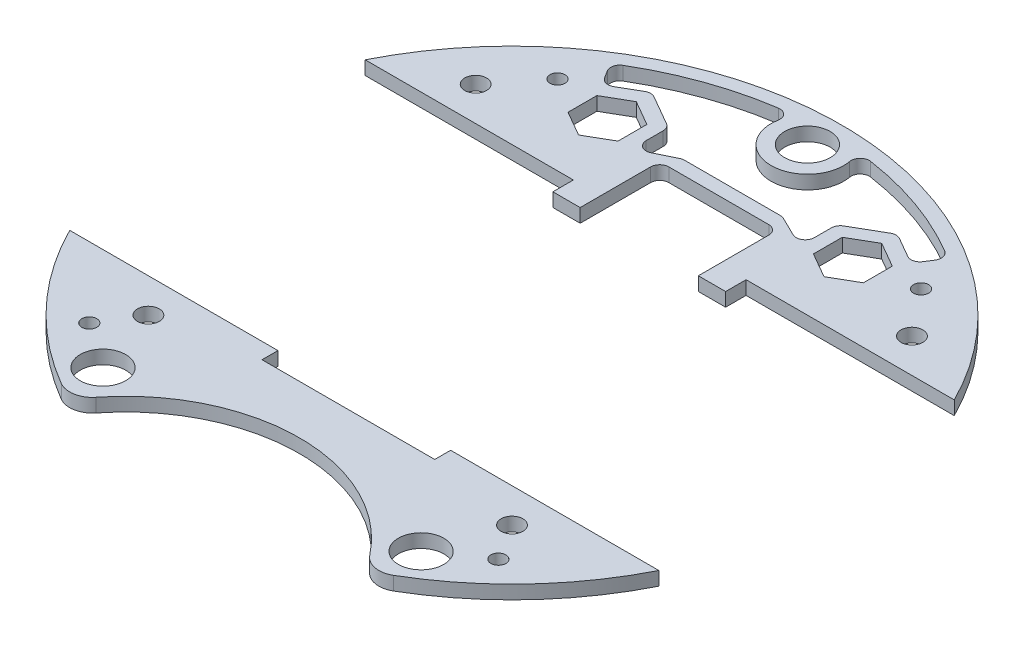
from build123d import *

# Parameters (mm, degrees)
BOSS_EXTRUDE1_DEPTH  = 3
SOLENOID_PLACEMENT_W = 38
SOLENOID_PLACEMENT_H = 64
CUT_EXTRUDE1_DEPTH   = 103.574363269
CUT_EXTRUDE4_DEPTH   = 103.574363269
CUT_EXTRUDE5_DEPTH   = 103.574363269
SKETCH6_R            = 2.4
CUT_EXTRUDE6_DEPTH   = 103.574363269
CUT_EXTRUDE3_DEPTH   = 103.574363269
SKETCH7_R            = 5
CUT_EXTRUDE7_DEPTH   = 98.289516393
SKETCH8_R            = 5
CUT_EXTRUDE9_DEPTH   = 98.289516393
SKETCH9_R            = 1.65
CUT_EXTRUDE10_DEPTH  = 98.289516393
CUT_EXTRUDE12_DEPTH  = 98.289516393


with BuildPart() as part:
    # Sketch1 → Boss-Extrude1 (new body)
    with BuildSketch(Plane(origin=(0, 0, 0), x_dir=(1, 0, 0), z_dir=(0, 1, 0))):
        with BuildLine():
            ThreePointArc((36.543377003, -62.616544118), (0, 72.5), (-36.543377003, -62.616544118))
            ThreePointArc((-36.543377003, -62.616544118), (-33.085954668, -63.20954405), (-30.089832649, -61.38507948))
            ThreePointArc((-30.089832649, -61.38507948), (0, -46.75), (30.089832649, -61.38507948))
            ThreePointArc((30.089832649, -61.38507948), (33.085954668, -63.20954405), (36.543377003, -62.616544118))
        make_face()
    extrude(amount=BOSS_EXTRUDE1_DEPTH)

    # solenoid placement → Cut-Extrude1 (cut, through all)
    with BuildSketch(Plane(origin=(0, 3, 0), x_dir=(1, 0, 0), z_dir=(0, 1, 0))):
        with Locations((0, -4)):
            Rectangle(SOLENOID_PLACEMENT_W, SOLENOID_PLACEMENT_H)
    extrude(amount=-CUT_EXTRUDE1_DEPTH, mode=Mode.SUBTRACT)

    # Sketch4 → Cut-Extrude4 (cut, through all)
    with BuildSketch(Plane(origin=(0, 3, 0), x_dir=(1, 0, 0), z_dir=(0, 1, 0))):
        with BuildLine():
            Line((13, 28), (13, 43.5))
            ThreePointArc((13, 43.5), (12.414213562, 44.914213562), (11, 45.5))
            Line((11, 45.5), (-11, 45.5))
            ThreePointArc((-11, 45.5), (-12.414213562, 44.914213562), (-13, 43.5))
            Line((-13, 43.5), (-13, 28))
            Line((-13, 28), (13, 28))
        make_face()
    extrude(amount=-CUT_EXTRUDE4_DEPTH, mode=Mode.SUBTRACT)

    # Sketch5 → Cut-Extrude5 (cut, through all)
    with BuildSketch(Plane(origin=(0, 3, 0), x_dir=(1, 0, 0), z_dir=(0, 1, 0))):
        Polygon((-21.5, 51.175426481), (-27, 54.350852961), (-32.5, 51.175426481), (-32.5, 44.824573519), (-27, 41.649147039), (-21.5, 44.824573519), align=None)
        Polygon((21.5, 51.175426481), (21.5, 44.824573519), (27, 41.649147039), (32.5, 44.824573519), (32.5, 51.175426481), (27, 54.350852961), align=None)
    extrude(amount=-CUT_EXTRUDE5_DEPTH, mode=Mode.SUBTRACT)

    # Sketch6 → Cut-Extrude6 (cut, through all)
    with BuildSketch(Plane(origin=(0, 3, 0), x_dir=(1, 0, 0), z_dir=(0, 1, 0))):
        with Locations((40, -40)):
            Circle(SKETCH6_R)
        with Locations((-40, -40)):
            Circle(SKETCH6_R)
        with Locations((48, 40)):
            Circle(SKETCH6_R)
        with Locations((-48, 40)):
            Circle(SKETCH6_R)
    extrude(amount=-CUT_EXTRUDE6_DEPTH, mode=Mode.SUBTRACT)

    # Sketch3 → Cut-Extrude3 (cut, through all)
    with BuildSketch(Plane(origin=(0, 3, 0), x_dir=(1, 0, 0), z_dir=(0, 1, 0))):
        Polygon((-19, 28), (-19, 32.5), (-72.5, 32.5), (-72.5, -32.5), (72.5, -32.5), (72.5, 32.5), (19, 32.5), (19, 28), align=None)
    extrude(amount=-CUT_EXTRUDE3_DEPTH, mode=Mode.SUBTRACT)


with BuildPart() as cut_extrude3_piece_1:
    # of the separate pieces the step leaves, piece 1, a body of its own (cut_extrude3_pieces)
    add(part.part.solids().sort_by_distance((64.807406984, 0, -32.5))[0])

    # Sketch8 → Cut-Extrude9 (cut, through all)
    with BuildSketch(Plane.XZ.offset(-3)):
        with Locations((0, -65)):
            Circle(SKETCH8_R)
    extrude(amount=CUT_EXTRUDE9_DEPTH, mode=Mode.SUBTRACT)


with BuildPart() as cut_extrude3_piece_2:
    # of the separate pieces the step leaves, piece 2, a body of its own (cut_extrude3_pieces)
    add(part.part.solids().sort_by_distance((-36.543377003, 0, 62.616544118))[0])

    # Sketch7 → Cut-Extrude7 (cut, through all)
    with BuildSketch(Plane(origin=(0, 3, 0), x_dir=(1, 0, 0), z_dir=(0, 1, 0))):
        with Locations((35, -55)):
            Circle(SKETCH7_R)
        with Locations((-35, -55)):
            Circle(SKETCH7_R)
    extrude(amount=-CUT_EXTRUDE7_DEPTH, mode=Mode.SUBTRACT)


with BuildPart() as cut_extrude10_tool:
    # Sketch9 → Cut-Extrude10 (new, through all)
    with BuildSketch(Plane(origin=(0, 3, 0), x_dir=(1, 0, 0), z_dir=(0, 1, 0))):
        with Locations((45, -48)):
            Circle(SKETCH9_R)
        with Locations((-45, -48)):
            Circle(SKETCH9_R)
        with Locations((40, 50)):
            Circle(SKETCH9_R)
        with Locations((-40, 50)):
            Circle(SKETCH9_R)
    extrude(amount=-CUT_EXTRUDE10_DEPTH)


with BuildPart() as cut_extrude3_piece_1_1:
    add(cut_extrude3_piece_1.part)

    # Cut-Extrude10: cut by cut_extrude10_tool
    add(cut_extrude10_tool.part, mode=Mode.SUBTRACT)

    # Sketch10 → Cut-Extrude12 (cut, through all)
    with BuildSketch(Plane.XZ):
        with BuildLine():
            ThreePointArc((-15.619887154, -46.235992589), (-17.558247208, -46.334843316), (-18.5, -48.031932838))
            Line((-18.5, -48.031932838), (-18.5, -51.75277675))
            ThreePointArc((-18.5, -51.75277675), (-18.767949192, -52.75277675), (-19.5, -53.484827557))
            Line((-19.5, -53.484827557), (-26, -57.237604307))
            ThreePointArc((-26, -57.237604307), (-27, -57.505553499), (-28, -57.237604307))
            Line((-28, -57.237604307), (-32.336247441, -54.73407068))
            ThreePointArc((-32.336247441, -54.73407068), (-33.814934269, -54.524251533), (-35.026688711, -55.397286461))
            Line((-35.026688711, -55.397286461), (-36.057344072, -57.027343779))
            ThreePointArc((-36.057344072, -57.027343779), (-36.311279162, -58.56458095), (-35.385181403, -59.817547066))
            ThreePointArc((-35.385181403, -59.817547066), (-23.193446557, -65.515754112), (-10.132084292, -68.757478632))
            ThreePointArc((-10.132084292, -68.757478632), (-8.40348615, -68.169871795), (-7.872410817, -66.423076923))
            ThreePointArc((-7.872410817, -66.423076923), (0, -57), (7.872410817, -66.423076923))
            ThreePointArc((7.872410817, -66.423076923), (8.40348615, -68.169871795), (10.132084292, -68.757478632))
            ThreePointArc((10.132084292, -68.757478632), (23.193446557, -65.515754112), (35.385181403, -59.817547066))
            ThreePointArc((35.385181403, -59.817547066), (36.311279162, -58.56458095), (36.057344072, -57.027343779))
            Line((36.057344072, -57.027343779), (35.026688711, -55.397286461))
            ThreePointArc((35.026688711, -55.397286461), (33.814934269, -54.524251533), (32.336247441, -54.73407068))
            Line((32.336247441, -54.73407068), (28, -57.237604307))
            ThreePointArc((28, -57.237604307), (27, -57.505553499), (26, -57.237604307))
            Line((26, -57.237604307), (19.5, -53.484827557))
            ThreePointArc((19.5, -53.484827557), (18.767949192, -52.75277675), (18.5, -51.75277675))
            Line((18.5, -51.75277675), (18.5, -48.031932838))
            ThreePointArc((18.5, -48.031932838), (17.558247208, -46.334843316), (15.619887154, -46.235992589))
            Line((15.619887154, -46.235992589), (11.416400149, -48.295940249))
            ThreePointArc((11.416400149, -48.295940249), (10.988017035, -48.448317287), (10.536287302, -48.5))
            Line((10.536287302, -48.5), (-10.536287302, -48.5))
            ThreePointArc((-10.536287302, -48.5), (-10.988017035, -48.448317287), (-11.416400149, -48.295940249))
            Line((-11.416400149, -48.295940249), (-15.619887154, -46.235992589))
        make_face()
    extrude(amount=-CUT_EXTRUDE12_DEPTH, mode=Mode.SUBTRACT)


with BuildPart() as cut_extrude3_piece_2_1:
    add(cut_extrude3_piece_2.part)

    # Cut-Extrude10: cut by cut_extrude10_tool
    add(cut_extrude10_tool.part, mode=Mode.SUBTRACT)


solid = Compound([cut_extrude3_piece_1_1.part, cut_extrude3_piece_2_1.part])
